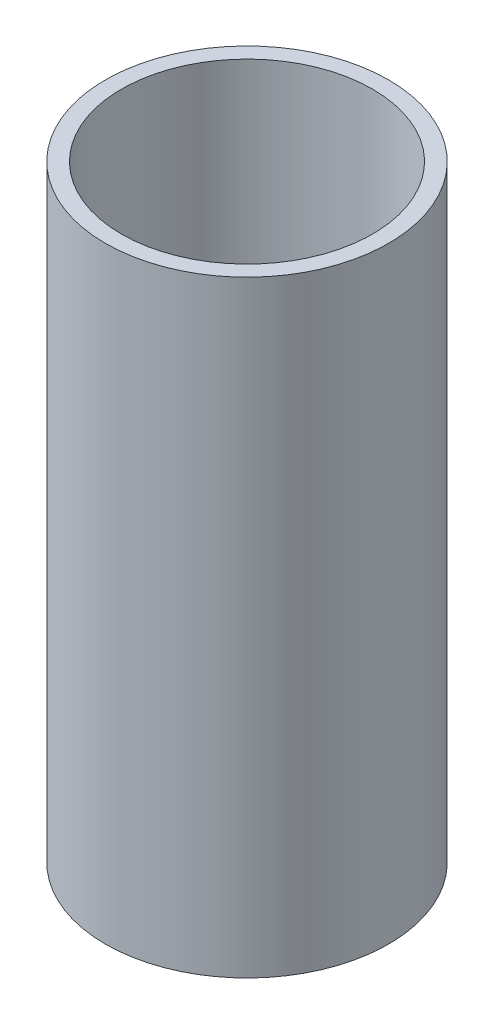
from build123d import *

# Parameters (mm, degrees)
SKETCH1_R           = 60
BOSS_EXTRUDE1_DEPTH = 257.158489446
SKETCH2_R           = 53.201847063
CUT_EXTRUDE1_DEPTH  = 271.796027841


with BuildPart() as part:
    # Sketch1 → Boss-Extrude1 (new body)
    with BuildSketch(Plane(origin=(0, 0, 0), x_dir=(1, 0, 0), z_dir=(0, 1, 0))):
        Circle(SKETCH1_R)
    extrude(amount=BOSS_EXTRUDE1_DEPTH)

    # Sketch2 → Cut-Extrude1 (cut, through all)
    with BuildSketch(Plane(origin=(0, 0, 0), x_dir=(1, 0, 0), z_dir=(0, 1, 0))):
        Circle(SKETCH2_R)
    extrude(amount=CUT_EXTRUDE1_DEPTH, mode=Mode.SUBTRACT)


solid = part.part
